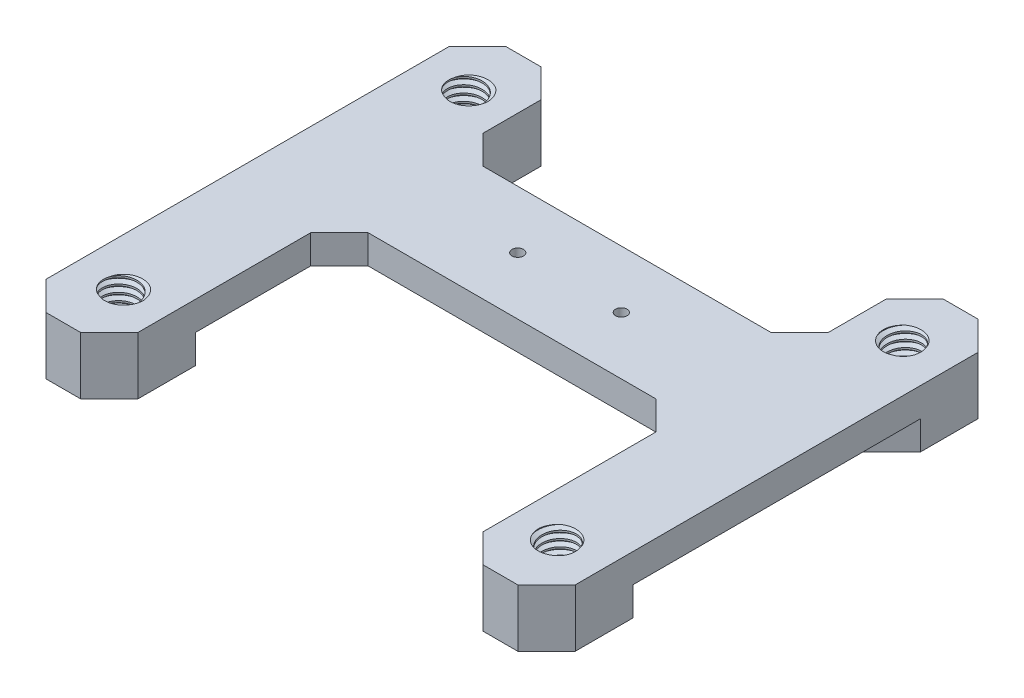
from build123d import *

# Parameters (mm, degrees)
SKETCH1_W                = 60
SKETCH1_H                = 20
BOSS_EXTRUDE1_DEPTH      = 5
SKETCH2_W                = 16
SKETCH2_H                = 80
SKETCH2_R                = 3
BOSS_EXTRUDE2_DEPTH      = 10
SKETCH3_W                = 16
SKETCH3_H                = 40
CUT_EXTRUDE1_DEPTH       = 5
THREAD1_PITCH            = 1.25
LPATTERN1_COUNT          = 2
LPATTERN1_PITCH          = 60
CHAMFER1_SIZE            = 5
CHAMFER2_SIZE            = 5
MIRROR1_COPY_1_PITCH     = 1.25
CHAMFER1_OF_MIRROR1_SIZE = 5
CHAMFER2_OF_MIRROR1_SIZE = 5
SKETCH8_R                = 1
CUT_EXTRUDE2_DEPTH       = 5


with BuildPart() as part:
    # Sketch1 → Boss-Extrude1 (new body)
    with BuildSketch(Plane(origin=(0, 0, 0), x_dir=(1, 0, 0), z_dir=(0, 1, 0))):
        Rectangle(SKETCH1_W, SKETCH1_H)
    extrude(amount=-BOSS_EXTRUDE1_DEPTH)

    # Sketch2 → Boss-Extrude2 (add)
    with BuildSketch(Plane(origin=(0, 0, 0), x_dir=(1, 0, 0), z_dir=(0, 1, 0))):
        with Locations((-38, -10)):
            Rectangle(SKETCH2_W, SKETCH2_H)
        with Locations(Location((-38, 20, 0), (0, 0, 270))):
            Circle(SKETCH2_R, mode=Mode.SUBTRACT)
        with Locations(Location((-38, -40, 0), (0, 0, 270))):
            Circle(SKETCH2_R, mode=Mode.SUBTRACT)
    boss_extrude2 = extrude(amount=-BOSS_EXTRUDE2_DEPTH)

    # Sketch3 → Cut-Extrude1 (cut)
    with BuildSketch(Plane.XZ.offset(10)):
        with Locations((-38, 10)):
            Rectangle(SKETCH3_W, SKETCH3_H)
    cut_extrude1 = extrude(amount=-CUT_EXTRUDE1_DEPTH, mode=Mode.SUBTRACT)

    # Thread1: the profile of Thread Profile1 profile screwed along a right-hand helix of 8.8 turns, 8 arcs to a turn; built about Z, then put on its axis
    thread1_z = Axis((0, 0, 0), (0, 0, 1))
    thread1_corners = [(2.9997, 0, -0.000173205), (3.676582344, 0, 0.390624998), (3.676582344, 0, 0.546874998), (2.9997, 0, 0.937673202)]
    with BuildLine(mode=Mode.PRIVATE) as thread1_profile:
        Line(thread1_corners[0], thread1_corners[1])
        Line(thread1_corners[1], thread1_corners[2])
        Line(thread1_corners[2], thread1_corners[3])
        Line(thread1_corners[3], thread1_corners[0])
    thread1_cap = Face(thread1_profile.wire())
    thread1_turn_angles = [0, 22.5, 45, 67.5, 90, 112.5, 135, 157.5, 180, 202.5, 225, 247.5, 270, 292.5, 315, 337.5, 360]
    thread1_turn_weights = [1, 0.9238795325112867, 1, 0.9238795325112867, 1, 0.9238795325112867, 1, 0.9238795325112867, 1, 0.9238795325112867, 1, 0.9238795325112867, 1, 0.9238795325112867, 1, 0.9238795325112867, 1]
    thread1_turn_rails = [Edge.make_bspline([Vector(p[0], p[1], 0).rotate(thread1_z, thread1_turn_angles[k]) / thread1_turn_weights[k] + Vector(0, 0, p[2] + THREAD1_PITCH * thread1_turn_angles[k] / 360) for k in range(17)], [0, 0, 0, 1, 1, 2, 2, 3, 3, 4, 4, 5, 5, 6, 6, 7, 7, 8, 8, 8], 2, thread1_turn_weights) for p in thread1_corners]
    thread1_turn_sides = [Face.make_surface_from_curves(thread1_turn_rails[p[0]], thread1_turn_rails[p[1]]) for p in [(0, 1), (1, 2), (2, 3), (3, 0)]]
    thread1_last_angles = [2880, 2902.5, 2925, 2947.5, 2970, 2992.5, 3015, 3037.5, 3060, 3082.5, 3105, 3127.5, 3150, 3159, 3168]
    thread1_last_weights = [1, 0.9238795325112867, 1, 0.9238795325112867, 1, 0.9238795325112867, 1, 0.9238795325112867, 1, 0.9238795325112867, 1, 0.9238795325112867, 1, 0.9876883405951378, 1]
    thread1_last_rails = [Edge.make_bspline([Vector(p[0], p[1], 0).rotate(thread1_z, thread1_last_angles[k]) / thread1_last_weights[k] + Vector(0, 0, p[2] + THREAD1_PITCH * thread1_last_angles[k] / 360) for k in range(15)], [0, 0, 0, 1, 1, 2, 2, 3, 3, 4, 4, 5, 5, 6, 6, 7, 7, 7], 2, thread1_last_weights) for p in thread1_corners]
    thread1_last_sides = [Face.make_surface_from_curves(thread1_last_rails[p[0]], thread1_last_rails[p[1]]) for p in [(0, 1), (1, 2), (2, 3), (3, 0)]]
    thread1 = Plane(origin=(-38, 1, 40), x_dir=(-1, 0, 0), z_dir=(0, -1, 0)) * Solid(Shell([*[p.moved(Location((0, 0, THREAD1_PITCH * i))) for i in range(8) for p in thread1_turn_sides], *thread1_last_sides, thread1_cap, thread1_cap.rotate(thread1_z, 3168).moved(Location((0, 0, THREAD1_PITCH * 3168 / 360)))]))
    add(thread1, mode=Mode.SUBTRACT)

    # LPattern1: Thread1 ×2
    with Locations(*[(0, 0, -i * LPATTERN1_PITCH) for i in range(1, LPATTERN1_COUNT)]):
        add(thread1, mode=Mode.SUBTRACT)

    # Chamfer1
    chamfer1_edges = [part.edges().sort_by_distance(p)[0] for p in [
        (-30, -5, -30),
        (-30, -5, 50),
        (-46, -5, 50),
        (-46, -5, -30),
        (-46, -7.5, -10),
        (-46, -7.5, 30),
        (-30, -7.5, 30),
        (-30, -2.5, 10),
        (-30, -2.5, -10),
    ]]
    chamfer(chamfer1_edges, length=CHAMFER1_SIZE)

    # Chamfer2
    chamfer2_edges = [part.edges().sort_by_distance(p)[0] for p in [
        (-30, -7.5, -10),
    ]]
    chamfer(chamfer2_edges, length=CHAMFER2_SIZE)

    # Mirror1: Boss-Extrude2, Cut-Extrude1, Thread1 across plane
    add(boss_extrude2.mirror(Plane(origin=(0, 0, 0), x_dir=(0, 0, 1), z_dir=(1, 0, 0))))
    add(cut_extrude1.mirror(Plane(origin=(0, 0, 0), x_dir=(0, 0, 1), z_dir=(1, 0, 0))), mode=Mode.SUBTRACT)
    add(thread1.mirror(Plane(origin=(0, 0, 0), x_dir=(0, 0, 1), z_dir=(1, 0, 0))), mode=Mode.SUBTRACT)

    # Mirror1 copy 1: the profile of Mirror1 copy 1 sketch screwed along a left-hand helix of 8.8 turns, 8 arcs to a turn; built about Z, then put on its axis
    mirror1_copy_1_z = Axis((0, 0, 0), (0, 0, 1))
    mirror1_copy_1_corners = [(2.9997, 0, -0.000173205), (3.676582344, 0, 0.390624998), (3.676582344, 0, 0.546874998), (2.9997, 0, 0.937673202)]
    with BuildLine(mode=Mode.PRIVATE) as mirror1_copy_1_profile:
        Line(mirror1_copy_1_corners[0], mirror1_copy_1_corners[1])
        Line(mirror1_copy_1_corners[1], mirror1_copy_1_corners[2])
        Line(mirror1_copy_1_corners[2], mirror1_copy_1_corners[3])
        Line(mirror1_copy_1_corners[3], mirror1_copy_1_corners[0])
    mirror1_copy_1_cap = Face(mirror1_copy_1_profile.wire())
    mirror1_copy_1_turn_angles = [0, -22.5, -45, -67.5, -90, -112.5, -135, -157.5, -180, -202.5, -225, -247.5, -270, -292.5, -315, -337.5, -360]
    mirror1_copy_1_turn_weights = [1, 0.9238795325112867, 1, 0.9238795325112867, 1, 0.9238795325112867, 1, 0.9238795325112867, 1, 0.9238795325112867, 1, 0.9238795325112867, 1, 0.9238795325112867, 1, 0.9238795325112867, 1]
    mirror1_copy_1_turn_rails = [Edge.make_bspline([Vector(p[0], p[1], 0).rotate(mirror1_copy_1_z, mirror1_copy_1_turn_angles[k]) / mirror1_copy_1_turn_weights[k] + Vector(0, 0, p[2] + -MIRROR1_COPY_1_PITCH * mirror1_copy_1_turn_angles[k] / 360) for k in range(17)], [0, 0, 0, 1, 1, 2, 2, 3, 3, 4, 4, 5, 5, 6, 6, 7, 7, 8, 8, 8], 2, mirror1_copy_1_turn_weights) for p in mirror1_copy_1_corners]
    mirror1_copy_1_turn_sides = [Face.make_surface_from_curves(mirror1_copy_1_turn_rails[p[0]], mirror1_copy_1_turn_rails[p[1]]) for p in [(0, 1), (1, 2), (2, 3), (3, 0)]]
    mirror1_copy_1_last_angles = [-2880, -2902.5, -2925, -2947.5, -2970, -2992.5, -3015, -3037.5, -3060, -3082.5, -3105, -3127.5, -3150, -3159, -3168]
    mirror1_copy_1_last_weights = [1, 0.9238795325112867, 1, 0.9238795325112867, 1, 0.9238795325112867, 1, 0.9238795325112867, 1, 0.9238795325112867, 1, 0.9238795325112867, 1, 0.9876883405951378, 1]
    mirror1_copy_1_last_rails = [Edge.make_bspline([Vector(p[0], p[1], 0).rotate(mirror1_copy_1_z, mirror1_copy_1_last_angles[k]) / mirror1_copy_1_last_weights[k] + Vector(0, 0, p[2] + -MIRROR1_COPY_1_PITCH * mirror1_copy_1_last_angles[k] / 360) for k in range(15)], [0, 0, 0, 1, 1, 2, 2, 3, 3, 4, 4, 5, 5, 6, 6, 7, 7, 7], 2, mirror1_copy_1_last_weights) for p in mirror1_copy_1_corners]
    mirror1_copy_1_last_sides = [Face.make_surface_from_curves(mirror1_copy_1_last_rails[p[0]], mirror1_copy_1_last_rails[p[1]]) for p in [(0, 1), (1, 2), (2, 3), (3, 0)]]
    mirror1_copy_1 = Plane(origin=(38, 1, -20), x_dir=(1, 0, 0), z_dir=(0, -1, 0)) * Solid(Shell([*[p.moved(Location((0, 0, MIRROR1_COPY_1_PITCH * i))) for i in range(8) for p in mirror1_copy_1_turn_sides], *mirror1_copy_1_last_sides, mirror1_copy_1_cap, mirror1_copy_1_cap.rotate(mirror1_copy_1_z, -3168).moved(Location((0, 0, -MIRROR1_COPY_1_PITCH * -3168 / 360)))]))
    add(mirror1_copy_1, mode=Mode.SUBTRACT)

    # Chamfer1 of Mirror1
    chamfer1_of_mirror1_edges = [part.edges().sort_by_distance(p)[0] for p in [
        (30, -5, -30),
        (30, -5, 50),
        (46, -5, 50),
        (46, -5, -30),
        (46, -7.5, -10),
        (46, -7.5, 30),
        (30, -7.5, 30),
        (30, -2.5, 10),
        (30, -2.5, -10),
    ]]
    chamfer(chamfer1_of_mirror1_edges, length=CHAMFER1_OF_MIRROR1_SIZE)

    # Chamfer2 of Mirror1
    chamfer2_of_mirror1_edges = [part.edges().sort_by_distance(p)[0] for p in [
        (30, -7.5, -10),
    ]]
    chamfer(chamfer2_of_mirror1_edges, length=CHAMFER2_OF_MIRROR1_SIZE)

    # Sketch8 → Cut-Extrude2 (cut)
    with BuildSketch(Plane(origin=(0, 0, 0), x_dir=(1, 0, 0), z_dir=(0, 1, 0))):
        with Locations(Location((9, 0, 0), (0, 0, 270))):
            Circle(SKETCH8_R)
        with Locations(Location((-9, 0, 0), (0, 0, 270))):
            Circle(SKETCH8_R)
    extrude(amount=-CUT_EXTRUDE2_DEPTH, mode=Mode.SUBTRACT)


solid = part.part
